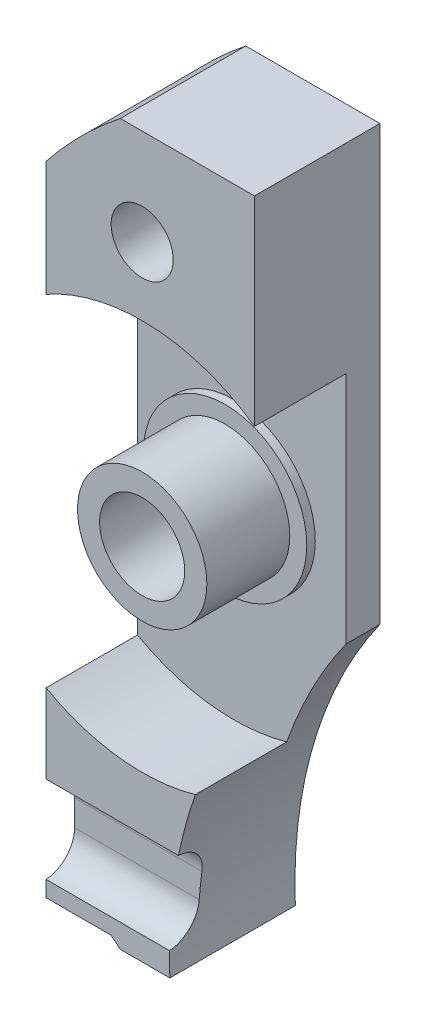
from build123d import *

# Parameters (mm, degrees)
SKETCH1_W           = 12.25
SKETCH1_H           = 42.3
BOSS_EXTRUDE1_DEPTH = 7.375
SKETCH2_R           = 1.825
SKETCH2_R_2         = 2.5
CUT_EXTRUDE1_DEPTH  = 24.22129949
CUT_EXTRUDE2_DEPTH  = 24.22129949
SKETCH4_R           = 11.5
CUT_EXTRUDE3_DEPTH  = 5.375
BOSS_EXTRUDE2_START = 0.5
SKETCH5_R           = 4.8
SKETCH5_R_2         = 2.5
BOSS_EXTRUDE2_DEPTH = 0.5
BOSS_EXTRUDE3_START = 4.875
SKETCH6_R           = 3.8
SKETCH6_R_2         = 2.5
BOSS_EXTRUDE3_DEPTH = 4.875
BOSS_EXTRUDE4_REACH = 27.53
CUT_EXTRUDE4_DEPTH  = 26.529896802
SKETCH9_R           = 3.2
CUT_EXTRUDE5_DEPTH  = 4


with BuildPart() as part:
    # Sketch1 → Boss-Extrude1 (new body)
    with BuildSketch(Plane.XY):
        Rectangle(SKETCH1_W, SKETCH1_H)
    extrude(amount=BOSS_EXTRUDE1_DEPTH)

    # Sketch2 → Cut-Extrude1 (cut, through all)
    with BuildSketch(Plane.XY.offset(7.375)):
        with Locations((-0.475, 15.5)):
            Circle(SKETCH2_R)
        with Locations((-0.475, 0)):
            Circle(SKETCH2_R_2)
    extrude(amount=-CUT_EXTRUDE1_DEPTH, mode=Mode.SUBTRACT)

    # Sketch3 → Cut-Extrude2 (cut, through all)
    with BuildSketch(Plane.XY.offset(7.375)):
        with BuildLine():
            Line((-6.125, -21.15), (-6.125, -16.783974467))
            ThreePointArc((-6.125, -16.783974467), (-4.066466825, -19.092268783), (-1.757457575, -21.15))
            Line((-1.757457575, -21.15), (-6.125, -21.15))
        make_face()
        with BuildLine():
            Line((-6.125, 16.789834467), (-6.125, 21.15))
            Line((-6.125, 21.15), (-1.764842259, 21.15))
            ThreePointArc((-1.764842259, 21.15), (-4.069800152, 19.094796032), (-6.125, 16.789834467))
        make_face()
        with BuildLine():
            Line((6.125, -4.351807973), (6.125, -21.15))
            Line((6.125, -21.15), (1.151863079, -21.15))
            ThreePointArc((1.151863079, -21.15), (2.238128282, -12.336341525), (6.125, -4.351807973))
        make_face()
    extrude(amount=-CUT_EXTRUDE2_DEPTH, mode=Mode.SUBTRACT)

    # Sketch4 → Cut-Extrude3 (cut)
    with BuildSketch(Plane.XY.offset(7.375)):
        with Locations((-0.475, 0)):
            Circle(SKETCH4_R)
    extrude(amount=-CUT_EXTRUDE3_DEPTH, mode=Mode.SUBTRACT)

    # Sketch5 → Boss-Extrude2 (add)
    with BuildSketch(Plane.XY.offset(2).offset(BOSS_EXTRUDE2_START)):
        with Locations((-0.475, 0)):
            Circle(SKETCH5_R)
        with Locations((-0.475, 0)):
            Circle(SKETCH5_R_2, mode=Mode.SUBTRACT)
    extrude(amount=-BOSS_EXTRUDE2_DEPTH)

    # Sketch6 → Boss-Extrude3 (add)
    with BuildSketch(Plane.XY.offset(2.5).offset(BOSS_EXTRUDE3_START)):
        with Locations((-0.475, 0)):
            Circle(SKETCH6_R)
        with Locations((-0.475, 0)):
            Circle(SKETCH6_R_2, mode=Mode.SUBTRACT)
    extrude(amount=-BOSS_EXTRUDE3_DEPTH)

    # Sketch7 → Boss-Extrude4 (add, up to next)
    with BuildSketch(Plane(origin=(-6.125, 0, 0), x_dir=(0, 0, -1), z_dir=(1, 0, 0)), mode=Mode.PRIVATE) as boss_extrude4_sk1:
        with BuildLine():
            Line((-7.375, -13.721160181), (-7.375, -20.698803049))
            ThreePointArc((-7.375, -20.698803049), (-2.25, -17.209981615), (-7.375, -13.721160181))
        make_face()
    boss_extrude4_tool1 = extrude(boss_extrude4_sk1.sketch, amount=BOSS_EXTRUDE4_REACH, mode=Mode.PRIVATE) - part.part
    add(boss_extrude4_tool1.solids().sort_by_distance((-6.125, -17.209982, 5.119864))[0])

    # Sketch8 → Cut-Extrude4 (cut, through all)
    with BuildSketch(Plane(origin=(-6.125, 0, 0), x_dir=(0, 0, -1), z_dir=(1, 0, 0))):
        with BuildLine():
            Line((-9.3, -17.973571615), (-9.3, -16.459481615))
            ThreePointArc((-9.3, -16.459481615), (-7.5, -14.659481615), (-5.7, -16.459481615))
            Line((-5.7, -16.459481615), (-5.7, -17.973571615))
            ThreePointArc((-5.7, -17.973571615), (-7.5, -19.773571615), (-9.3, -17.973571615))
        make_face()
    extrude(amount=CUT_EXTRUDE4_DEPTH, mode=Mode.SUBTRACT)

    # Sketch9 → Cut-Extrude5 (cut)
    with BuildSketch(Plane(origin=(0, 0, 0), x_dir=(-1, 0, 0), z_dir=(0, 0, -1))):
        with Locations((0.475, 15.5)):
            Circle(SKETCH9_R)
    extrude(amount=-CUT_EXTRUDE5_DEPTH, mode=Mode.SUBTRACT)


solid = part.part
